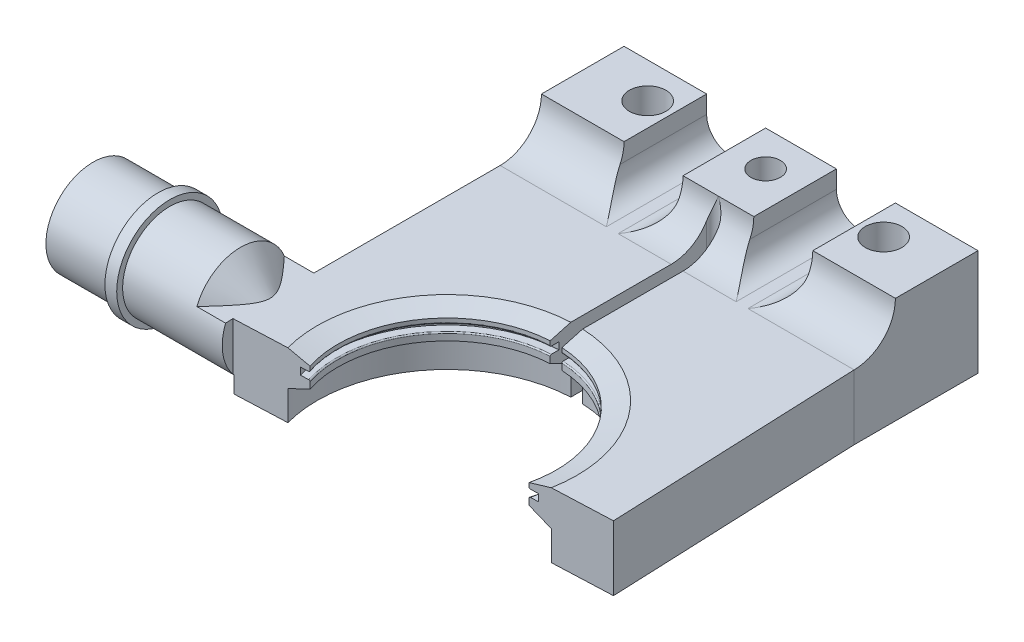
from build123d import *

# Parameters (mm, degrees)
CUT_EXTRUDE1_DEPTH       = 32.256999216
CUT_EXTRUDE1_DEPTH_BACK  = 32.256999216
BOSS_EXTRUDE1_DEPTH      = 3
BOSS_EXTRUDE1_DEPTH_BACK = 8
SKETCH3_R                = 2.5
SKETCH3_R_2              = 3.1
SKETCH4_W                = 60
SKETCH4_H                = 14
SKETCH4_R                = 3.1
SKETCH4_R_2              = 2.5
BOSS_EXTRUDE2_DEPTH      = 10
FILLET1_R                = 7
CUT_EXTRUDE2_DEPTH       = 68.823299831
CUT_EXTRUDE2_DEPTH_BACK  = 68.823299831
SKETCH6_W                = 8.309611266
SKETCH6_H                = 24.534536606
CUT_EXTRUDE3_DEPTH       = 5
CUT_EXTRUDE4_START       = 10
SKETCH7_W                = 10
SKETCH7_H                = 46.548957719
CUT_EXTRUDE4_DEPTH       = 7
FILLET2_R                = 4
FILLET3_R                = 0.6
BOSS_EXTRUDE5_START      = -30
SKETCH9_R                = 8
BOSS_EXTRUDE5_DEPTH      = 30
CHAMFER2_SIZE            = 5
BOSS_EXTRUDE8_DEPTH      = 11
FILLET11_R               = 0.2
BOSS_EXTRUDE15_START     = -11
SKETCH15_R               = 9
BOSS_EXTRUDE15_DEPTH     = 2
SKETCH17_W               = 5.75
SKETCH17_H               = 11
CUT_EXTRUDE6_DEPTH       = 62


# Some blends are built 0.0001 mm under size
with BuildPart() as part:
    # Sketch1 → Revolve1 (revolve)
    with BuildSketch(Plane.XY, mode=Mode.PRIVATE) as revolve1_sk:
        Polygon((-20, -0.05), (-20, 1.15), (-18.5, 1.15), (-18.5, 2.030737846), (-22, 3), (-22, -3), (-18.5, -1.329805879), (-18.5, -0.05), align=None)
    revolve(revolve1_sk.sketch.rotate(Axis((0, 0, 0), (0, 1, 0)), 270), axis=Axis((0, 0, 0), (0, 1, 0)))

    # Sketch2 → Cut-Extrude1 (cut, two sides: drawn at the far end of the back side and taken through both)
    with BuildSketch(Plane(origin=(0, 0, 0), x_dir=(1, 0, 0), z_dir=(0, 1, 0)).offset(-CUT_EXTRUDE1_DEPTH_BACK)):
        Polygon((0, 0), (-49.804197391, -23.224078652), (48.883629183, -22.794810646), align=None)
    extrude(amount=CUT_EXTRUDE1_DEPTH + CUT_EXTRUDE1_DEPTH_BACK, mode=Mode.SUBTRACT)

    # Sketch3 → Boss-Extrude1 (add, two sides: drawn at the far end of the back side and taken through both)
    with BuildSketch(Plane(origin=(0, 0, 0), x_dir=(1, 0, 0), z_dir=(0, 1, 0)).offset(-BOSS_EXTRUDE1_DEPTH_BACK)):
        with BuildLine():
            Line((-30, -9.297601758), (-30, 60))
            Line((-30, 60), (30, 60))
            Line((30, 60), (30, -9.297601758))
            Line((30, -9.297601758), (19.938771315, -9.297601758))
            ThreePointArc((19.938771315, -9.297601758), (0, 22), (-19.938771315, -9.297601758))
            Line((-19.938771315, -9.297601758), (-30, -9.297601758))
        make_face()
        with Locations(Location((0, 54, 0), (0, 0, 270))):
            Circle(SKETCH3_R, mode=Mode.SUBTRACT)
        with Locations(Location((-20, 54, 0), (0, 0, 270))):
            Circle(SKETCH3_R_2, mode=Mode.SUBTRACT)
        with Locations(Location((20, 54, 0), (0, 0, 270))):
            Circle(SKETCH3_R_2, mode=Mode.SUBTRACT)
    extrude(amount=BOSS_EXTRUDE1_DEPTH + BOSS_EXTRUDE1_DEPTH_BACK)

    # Sketch4 → Boss-Extrude2 (add)
    with BuildSketch(Plane(origin=(0, 0, 0), x_dir=(1, 0, 0), z_dir=(0, 1, 0))):
        with Locations((0, 53)):
            Rectangle(SKETCH4_W, SKETCH4_H)
        with Locations(Location((-20, 54, 0), (0, 0, 270))):
            Circle(SKETCH4_R, mode=Mode.SUBTRACT)
        with Locations(Location((0, 54, 0), (0, 0, 270))):
            Circle(SKETCH4_R_2, mode=Mode.SUBTRACT)
        with Locations(Location((20, 54, 0), (0, 0, 270))):
            Circle(SKETCH4_R, mode=Mode.SUBTRACT)
    extrude(amount=BOSS_EXTRUDE2_DEPTH)

    # Fillet1
    fillet1_edges = [part.edges().sort_by_distance(p)[0] for p in [
        (0, 3, -46),
    ]]
    fillet(fillet1_edges, radius=FILLET1_R - 0.0001)  # a hair under: the kernel refuses the full size

    # Sketch5 → Cut-Extrude2 (cut, two sides: drawn at the far end of the back side and taken through both)
    with BuildSketch(Plane(origin=(0, 0, 0), x_dir=(1, 0, 0), z_dir=(0, 1, 0)).offset(-CUT_EXTRUDE2_DEPTH_BACK)):
        with BuildLine():
            Line((1, 45), (1, -0.802300637))
            ThreePointArc((1, -0.802300637), (0, -1.802300637), (-1, -0.802300637))
            Line((-1, -0.802300637), (-1, 45))
            ThreePointArc((-1, 45), (0, 46), (1, 45))
        make_face()
    extrude(amount=CUT_EXTRUDE2_DEPTH + CUT_EXTRUDE2_DEPTH_BACK, mode=Mode.SUBTRACT)

    # Sketch6 → Cut-Extrude3 (cut)
    with BuildSketch(Plane(origin=(0, 0, 0), x_dir=(1, 0, 0), z_dir=(0, 1, 0))):
        with Locations((0, 60)):
            Rectangle(SKETCH6_W, SKETCH6_H)
    extrude(amount=CUT_EXTRUDE3_DEPTH, mode=Mode.SUBTRACT)

    # Sketch7 → Cut-Extrude4 (cut)
    with BuildSketch(Plane(origin=(0, 0, 0), x_dir=(1, 0, 0), z_dir=(0, 1, 0)).offset(CUT_EXTRUDE4_START)):
        with Locations((-11, 43.27447886)):
            Rectangle(SKETCH7_W, SKETCH7_H)
        with Locations((11, 43.27447886)):
            Rectangle(SKETCH7_W, SKETCH7_H)
    extrude(amount=-CUT_EXTRUDE4_DEPTH, mode=Mode.SUBTRACT)

    # Fillet2
    fillet2_edges = [part.edges().sort_by_distance(p)[0] for p in [
        (-16, 3, -49.50005),
        (-6, 3, -49.50005),
        (6, 3, -49.50005),
        (16, 3, -49.50005),
    ]]
    fillet(fillet2_edges, radius=FILLET2_R)

    # Fillet3
    fillet3_edges = [part.edges().sort_by_distance(p)[0] for p in [
        (-18.126155741, 0.55, 8.452365235),
        (18.126155741, 0.55, 8.452365235),
        (16.76669406, -0.689902939, 7.818437842),
        (16.76669406, 1.590368923, 7.818437842),
        (-16.76669406, -0.689902939, 7.818437842),
        (-16.76669406, 1.590368923, 7.818437842),
    ]]
    fillet(fillet3_edges, radius=FILLET3_R)

    # Sketch9 → Boss-Extrude5 (add)
    with BuildSketch(Plane(origin=(0, 0, 0), x_dir=(0, 0, -1), z_dir=(1, 0, 0)).offset(BOSS_EXTRUDE5_START)):
        Circle(SKETCH9_R)
    extrude(amount=-BOSS_EXTRUDE5_DEPTH)

    # Chamfer2
    # the kernel refuses this chamfer: 5 mm, written as the material it takes off along each edge
    with BuildSketch(Plane(origin=(-30, 0, 0), x_dir=(0, -0.940595145540607, -0.33953022278649125), z_dir=(0, -0.33953022278649125, 0.940595145540607))) as chamfer2_piece_1_section:
        Polygon((8, -CHAMFER2_SIZE), (8 - CHAMFER2_SIZE, 0), (8, 0), align=None)
    chamfer2_piece_1 = revolve(axis=Axis((-30, 0, 0), (1, 0, 0)), revolution_arc=320.303489407, mode=Mode.PRIVATE)
    chamfer2_piece_1 = split(chamfer2_piece_1, bisect_by=Plane(origin=(-31.835193595, 3, 0), z_dir=(0, 1, 0)), keep=Keep.TOP, mode=Mode.PRIVATE)
    add(chamfer2_piece_1, mode=Mode.SUBTRACT)

    # Sketch12 → Boss-Extrude8 (add)
    with BuildSketch(Plane(origin=(0, 3, 0), x_dir=(1, 0, 0), z_dir=(0, 1, 0))):
        Polygon((30, 39), (32, -9.297601758), (30, -9.297601758), align=None)
    extrude(amount=-BOSS_EXTRUDE8_DEPTH)

    # Fillet11
    fillet11_edges = [part.edges().sort_by_distance(p)[0] for p in [
        (15.714366537, 1.15, -9.762616675),
        (15.714366537, -0.05, -9.762616675),
        (17.981977521, -0.05, 8.385133827),
        (16.994984082, 1.15, 7.738283954),
        (17.981977521, 1.15, 8.385133827),
        (16.994984082, -0.05, 7.738283954),
        (-15.714366537, -0.05, -9.762616675),
        (-17.981977521, 1.15, 8.385133827),
        (-16.994984082, -0.05, 7.738283954),
        (-15.714366537, 1.15, -9.762616675),
        (-16.994984082, 1.15, 7.738283954),
        (-17.981977521, -0.05, 8.385133827),
    ]]
    fillet(fillet11_edges, radius=FILLET11_R)

    # Sketch15 → Boss-Extrude15 (add)
    with BuildSketch(Plane.ZY.offset(60).offset(BOSS_EXTRUDE15_START)):
        Circle(SKETCH15_R)
    extrude(amount=-BOSS_EXTRUDE15_DEPTH)

    # Sketch17 → Cut-Extrude6 (cut)
    with BuildSketch(Plane(origin=(31.560867022, 0, -1.306933093), x_dir=(-0.0413744647288413, 0, -0.9991437102181057), z_dir=(0.9991437102181057, 0, -0.0413744647288413))):
        with Locations((-7.738623188, -2.5)):
            Rectangle(SKETCH17_W, SKETCH17_H)
    extrude(amount=-CUT_EXTRUDE6_DEPTH, mode=Mode.SUBTRACT)


solid = part.part
